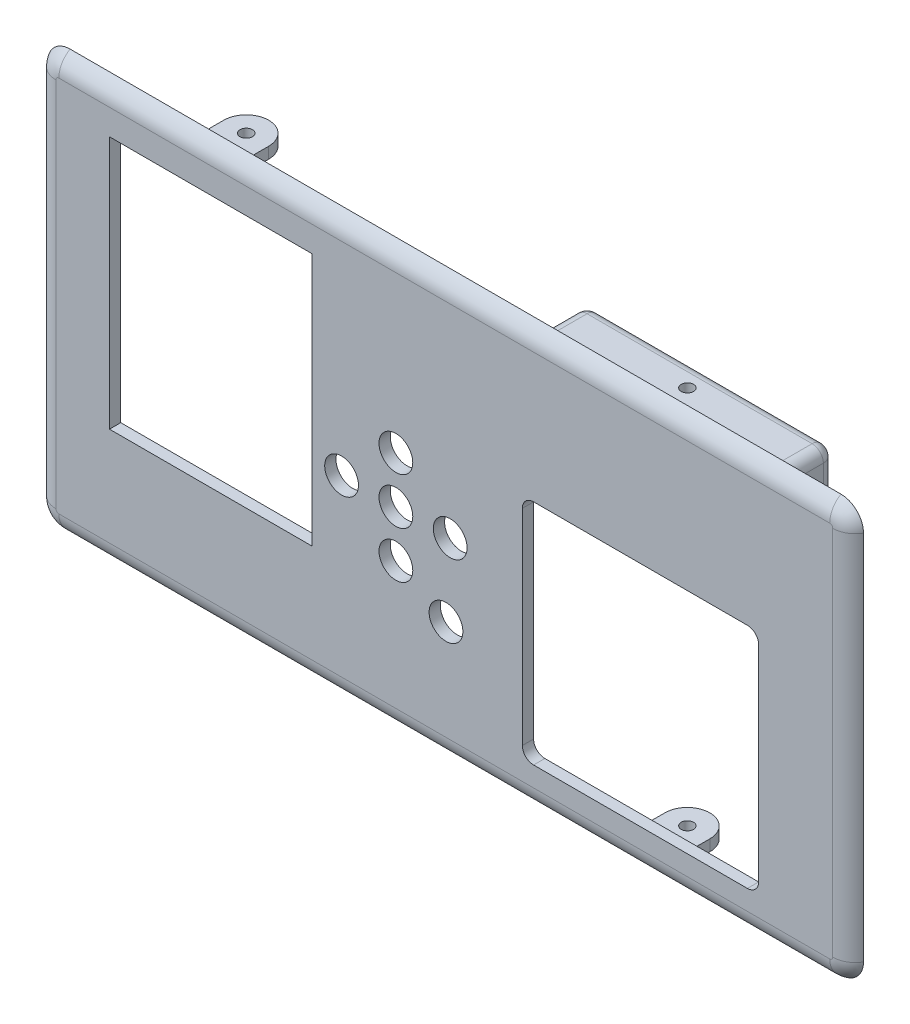
from build123d import *

# Parameters (mm, degrees)
ESBO_O1_W                = 74
ESBO_O1_H                = 145
ESBO_O1_R                = 3
ESBO_O1_W_2              = 45
ESBO_O1_H_2              = 36
ESBO_O1_W_3              = 40.5
ESBO_O1_H_3              = 42
RESSALTO_EXTRUS_O1_DEPTH = 2
CORTE_EXTRUS_O1_DEPTH    = 1.9
ESBO_O3_W                = 140.4
ESBO_O3_H                = 69.4
ESBO_O3_W_2              = 136.4
ESBO_O3_H_2              = 65.4
RESSALTO_EXTRUS_O2_DEPTH = 2
ESBO_O4_W                = 2
ESBO_O4_H                = 20.2
ESBO_O4_W_2              = 44
ESBO_O4_H_2              = 2
RESSALTO_EXTRUS_O3_DEPTH = 9.5
FILETE1_R                = 2
FILETE2_R                = 4
FILETE3_R                = 4
RESSALTO_EXTRUS_O4_START = 32.7
ESBO_O5_R                = 1.1
RESSALTO_EXTRUS_O4_DEPTH = 2
RESSALTO_EXTRUS_O5_START = -34.7
ESBO_O5_2_R              = 1.1
RESSALTO_EXTRUS_O5_DEPTH = 2
CORTE_EXTRUS_O2_START    = 60
ESBO_O6_R                = 1.1
CORTE_EXTRUS_O2_DEPTH    = 10
FILETE4_R                = 2
FILETE5_R                = 2


# Read off the part's stored shape, not the designer's step: Corte-extrusão1
# Some blends are built 0.0001 mm under size
with BuildPart() as part:
    # Esboço1 → Ressalto-extrusão1 (new body)
    with BuildSketch(Plane(origin=(0, 0, 0), x_dir=(0, 1, 0), z_dir=(0, 0, 1))):
        Rectangle(ESBO_O1_W, ESBO_O1_H)
        with Locations(Location((-15.76, -0.3, 0), (0, 0, 270))):
            Circle(ESBO_O1_R, mode=Mode.SUBTRACT)
        with Locations(Location((-2.51, 8.6, 0), (0, 0, 270))):
            Circle(ESBO_O1_R, mode=Mode.SUBTRACT)
        with Locations(Location((-2.51, 18.25, 0), (0, 0, 270))):
            Circle(ESBO_O1_R, mode=Mode.SUBTRACT)
        with Locations(Location((5.79, 8.6, 0), (0, 0, 270))):
            Circle(ESBO_O1_R, mode=Mode.SUBTRACT)
        with Locations(Location((-10.81, 8.6, 0), (0, 0, 270))):
            Circle(ESBO_O1_R, mode=Mode.SUBTRACT)
        with Locations(Location((-2.51, -1.05, 0), (0, 0, 270))):
            Circle(ESBO_O1_R, mode=Mode.SUBTRACT)
        with Locations((6.5, 41.5)):
            Rectangle(ESBO_O1_W_2, ESBO_O1_H_2, mode=Mode.SUBTRACT)
        with Locations((-9.75, -34.87)):
            Rectangle(ESBO_O1_W_3, ESBO_O1_H_3, mode=Mode.SUBTRACT)
    extrude(amount=RESSALTO_EXTRUS_O1_DEPTH)

    # Corte-extrusão1 outline → Corte-extrusão1 (cut)
    with BuildSketch(Plane.XY):
        with BuildLine():
            add(Edge.make_bspline(
                [(47.173076923, 20.014887154), (47.174117402, 19.887144883), (47.176164335, 19.635837546), (47.188599137, 19.265196932), (47.211039871, 18.907881572), (47.241211197, 18.563787309), (47.278695427, 18.23329202), (47.326276713, 17.916098024), (47.38400515, 17.612412265), (47.448100829, 17.320699761), (47.524756168, 17.041630215), (47.612248411, 16.774176813), (47.71048375, 16.516619516), (47.823333752, 16.27112642), (47.948089087, 16.036240474), (48.083511864, 15.811446978), (48.230039877, 15.596118976), (48.339687331, 15.462351114), (48.394230769, 15.395809129)],
                knots=[0, 0, 0, 0, 0.078572897, 0.15457644, 0.228069052, 0.298757677, 0.367016273, 0.432623994, 0.495987006, 0.557124588, 0.616282298, 0.673911173, 0.73015502, 0.78573453, 0.839985447, 0.893658314, 0.947100994, 1, 1, 1, 1], degree=3))
            add(Edge.make_bspline(
                [(48.41808143, 24.452700155), (48.376072031, 24.448933978), (48.289066696, 24.441133878), (48.164716323, 24.375822674), (48.047517354, 24.273758081), (47.936950213, 24.132232592), (47.831026682, 23.953113932), (47.728173244, 23.735847707), (47.631448957, 23.478860366), (47.536419534, 23.187474686), (47.452149745, 22.865001341), (47.377933609, 22.519002909), (47.314584822, 22.152442882), (47.261797032, 21.765361965), (47.223017275, 21.356852294), (47.194674233, 20.927892861), (47.176848872, 20.47826953), (47.174354104, 20.171788272), (47.173076923, 20.014887154)],
                knots=[0, 0, 0, 0, 0.025976356, 0.053799425, 0.085324753, 0.122080032, 0.164756432, 0.214371963, 0.27116, 0.335176716, 0.404637553, 0.478042656, 0.554885277, 0.635604766, 0.720597574, 0.809667408, 0.902560448, 1, 1, 1, 1], degree=3))
            add(Edge.make_bspline(
                [(49.717147436, 18.855745027), (49.715205809, 19.125030084), (49.711404915, 19.652177587), (49.676051144, 20.423825337), (49.617577401, 21.158884465), (49.549548777, 21.745008515), (49.48175624, 22.187734377), (49.432631837, 22.493061738), (49.375908371, 22.774188137), (49.319864514, 23.032924782), (49.258043975, 23.267867674), (49.192719997, 23.479307977), (49.126969256, 23.668526032), (49.055345373, 23.833879765), (48.981316862, 23.978418027), (48.908059534, 24.10442164), (48.830627618, 24.21026197), (48.753991128, 24.299555164), (48.672055656, 24.366670362), (48.589632254, 24.416584129), (48.504396718, 24.446781875), (48.446387138, 24.45075935), (48.41808143, 24.452700155)],
                knots=[0, 0, 0, 0, 0.135045219, 0.264362051, 0.387295344, 0.504802506, 0.560176281, 0.611916125, 0.659875824, 0.703987773, 0.744670877, 0.78166554, 0.814958934, 0.845080233, 0.871946957, 0.896381411, 0.918074, 0.937654067, 0.955215761, 0.970943646, 0.985821986, 1, 1, 1, 1], degree=3))
            Line((49.717147436, 18.855745027), (50.53125, 18.855745027))
            add(Edge.make_bspline(
                [(52.210336538, 25.775616822), (52.17294149, 25.773005571), (52.096942997, 25.767698688), (51.985224838, 25.728341562), (51.87592653, 25.66658728), (51.768521421, 25.580395808), (51.66332117, 25.46966362), (51.563251862, 25.332594748), (51.460001444, 25.175155295), (51.364108014, 24.992407374), (51.267895529, 24.791773706), (51.181550033, 24.571052094), (51.09967634, 24.334782242), (51.020093587, 24.082530437), (50.952386066, 23.812727195), (50.886062678, 23.527317323), (50.827775692, 23.22492747), (50.77474245, 22.900970715), (50.726576213, 22.546321407), (50.683724314, 22.151891944), (50.648582614, 21.712215169), (50.614805548, 21.22780213), (50.586698993, 20.698233695), (50.563093911, 20.124184291), (50.543961592, 19.50509332), (50.535587171, 19.077301409), (50.53125, 18.855745027)],
                knots=[0, 0, 0, 0, 0.015048386, 0.030583051, 0.047220886, 0.065467235, 0.085861122, 0.108586779, 0.133765552, 0.161670299, 0.191670667, 0.223400323, 0.257107107, 0.292439395, 0.329945595, 0.369167682, 0.410511454, 0.454017114, 0.501441039, 0.554723517, 0.613877757, 0.679175906, 0.750404081, 0.827575383, 0.910700101, 1, 1, 1, 1], degree=3))
            add(Edge.make_bspline(
                [(53.889423077, 20.073718785), (53.888030161, 20.283102787), (53.885310382, 20.691941717), (53.860324048, 21.288904323), (53.82420609, 21.854414299), (53.76731057, 22.38769486), (53.699725307, 22.889991174), (53.611019744, 23.36017394), (53.511201853, 23.799080448), (53.411267211, 24.142479037), (53.325736374, 24.398607042), (53.25964573, 24.575154331), (53.195932659, 24.74111878), (53.126825862, 24.893126456), (53.05864041, 25.034032625), (52.9890952, 25.162730252), (52.917705924, 25.279179091), (52.844252955, 25.383195199), (52.769829334, 25.474980144), (52.695295212, 25.556411075), (52.616587902, 25.622226643), (52.539500965, 25.679936919), (52.457959748, 25.72053042), (52.377862728, 25.75385708), (52.2943039, 25.771561189), (52.238498379, 25.774256602), (52.210336538, 25.775616822)],
                knots=[0, 0, 0, 0, 0.100445637, 0.1961281, 0.286600843, 0.37224573, 0.453370973, 0.529673874, 0.601715122, 0.669229587, 0.701151659, 0.731239722, 0.759664826, 0.786411815, 0.811316234, 0.834754852, 0.856560099, 0.876807909, 0.895789985, 0.913238703, 0.929648632, 0.944959968, 0.959289745, 0.973219138, 0.986485238, 1, 1, 1, 1], degree=3))
            add(Edge.make_bspline(
                [(53.460111178, 16.337115219), (53.494757466, 16.462947421), (53.566114049, 16.722108116), (53.651428458, 17.127444428), (53.726795753, 17.557394983), (53.786499376, 18.012078063), (53.832164822, 18.492094122), (53.8648751, 18.996899426), (53.886437951, 19.52708572), (53.88841282, 19.888721634), (53.889423077, 20.073718785)],
                knots=[0, 0, 0, 0, 0.103749396, 0.213679529, 0.329170671, 0.450752515, 0.578183648, 0.71248325, 0.852918978, 1, 1, 1, 1], degree=3))
            add(Edge.make_bspline(
                [(52.362980769, 14.581706565), (52.424956711, 14.634132297), (52.549654141, 14.739614422), (52.719468867, 14.919493477), (52.877179906, 15.114927831), (53.020320639, 15.327725282), (53.15095416, 15.555738454), (53.268629686, 15.800210055), (53.37464325, 16.061139096), (53.431241934, 16.243896367), (53.460111178, 16.337115219)],
                knots=[0, 0, 0, 0, 0.115770177, 0.23293302, 0.352361737, 0.473830575, 0.59851621, 0.727069683, 0.860786655, 1, 1, 1, 1], degree=3))
            Line((52.362980769, 14.581706565), (52.362980769, 12.241161693))
            add(Edge.make_bspline(
                [(54.703525641, 20.033967683), (54.701552521, 19.783782649), (54.697688705, 19.293863617), (54.671625107, 18.574734518), (54.622498237, 17.887771016), (54.561359899, 17.231920289), (54.475943016, 16.607947712), (54.375697017, 16.015135884), (54.255173494, 15.454224548), (54.136983855, 15.009058713), (54.035098553, 14.670475035), (53.953413472, 14.430964405), (53.868050064, 14.202947786), (53.778658722, 13.985426581), (53.685288067, 13.77886681), (53.586931429, 13.583763428), (53.484592367, 13.399673681), (53.378535309, 13.226323702), (53.267039463, 13.063971531), (53.15165886, 12.912465642), (53.029528299, 12.774285893), (52.906150218, 12.644504467), (52.777025489, 12.52725488), (52.644609747, 12.419369389), (52.506596519, 12.324132272), (52.410531692, 12.268633106), (52.362980769, 12.241161693)],
                knots=[0, 0, 0, 0, 0.088886706, 0.174060327, 0.255603603, 0.333549665, 0.408036485, 0.479300312, 0.547110699, 0.611786503, 0.642881203, 0.672714774, 0.701674448, 0.729369875, 0.756252549, 0.782190026, 0.806972588, 0.83106521, 0.854360183, 0.876920552, 0.898673545, 0.919848336, 0.940507791, 0.960593756, 0.980494388, 1, 1, 1, 1], degree=3))
            add(Edge.make_bspline(
                [(52.141964643, 28.116161693), (52.198024043, 28.113309586), (52.311916251, 28.107515146), (52.479363624, 28.051965586), (52.645025303, 27.968799498), (52.807251424, 27.849134176), (52.966873682, 27.697248217), (53.124893852, 27.512789049), (53.278240982, 27.294178305), (53.431787395, 27.046326694), (53.578190339, 26.768483054), (53.71789912, 26.465822489), (53.850209642, 26.139213722), (53.971964386, 25.787673002), (54.08431518, 25.411794764), (54.188939061, 25.012384879), (54.286276814, 24.588867984), (54.372681903, 24.14216899), (54.449795031, 23.676543969), (54.518732944, 23.196345668), (54.575038823, 22.702598688), (54.624047975, 22.195433528), (54.656973945, 21.6740478), (54.685175507, 21.139300885), (54.70111383, 20.591111629), (54.702715687, 20.221072378), (54.703525641, 20.033967683)],
                knots=[0, 0, 0, 0, 0.018753924, 0.038101119, 0.058616525, 0.080774388, 0.105428344, 0.132408932, 0.162110759, 0.194924196, 0.230160854, 0.267391214, 0.306715309, 0.348326823, 0.392146465, 0.438292407, 0.486816032, 0.53790158, 0.590897092, 0.645135551, 0.700625293, 0.75759512, 0.816045953, 0.8758646, 0.937232831, 1, 1, 1, 1], degree=3))
            add(Edge.make_bspline(
                [(50.731595553, 26.604029782), (50.78270337, 26.723130137), (50.879658004, 26.949070745), (51.046504159, 27.256255653), (51.212346246, 27.52014818), (51.388350916, 27.733667125), (51.566928739, 27.903005932), (51.751538044, 28.026615206), (51.945201089, 28.101263249), (52.077252133, 28.111261824), (52.141964643, 28.116161693)],
                knots=[0, 0, 0, 0, 0.178333778, 0.338310009, 0.480800466, 0.606741991, 0.71826832, 0.818451927, 0.911031135, 1, 1, 1, 1], degree=3))
            add(Edge.make_bspline(
                [(50.054236779, 23.862793805), (50.074415407, 23.999083607), (50.113890167, 24.265702685), (50.180104396, 24.655665274), (50.254403717, 25.026434815), (50.338033406, 25.378039883), (50.424524896, 25.711951131), (50.518024996, 26.027266873), (50.619188703, 26.323379554), (50.694776171, 26.512101507), (50.731595553, 26.604029782)],
                knots=[0, 0, 0, 0, 0.145998156, 0.285611199, 0.419112946, 0.546628653, 0.668554587, 0.784594676, 0.895073998, 1, 1, 1, 1], degree=3))
            add(Edge.make_bspline(
                [(48.421261518, 26.793245027), (48.463918677, 26.791247334), (48.549624759, 26.787233602), (48.675285101, 26.749581121), (48.797261841, 26.692082618), (48.914937652, 26.61001477), (49.029210682, 26.506357199), (49.139195231, 26.378293673), (49.247077494, 26.229106331), (49.349802378, 26.056009303), (49.450225706, 25.861189772), (49.546402913, 25.643153807), (49.640202633, 25.402278737), (49.730702034, 25.138736511), (49.815413736, 24.85170362), (49.90017777, 24.542894652), (49.981375429, 24.211097471), (50.029480273, 23.981138877), (50.054236779, 23.862793805)],
                knots=[0, 0, 0, 0, 0.035929926, 0.072189835, 0.109815248, 0.149403222, 0.192802437, 0.239731941, 0.291639746, 0.34803706, 0.409469869, 0.476567142, 0.54910076, 0.627628075, 0.711708692, 0.801687982, 0.897941408, 1, 1, 1, 1], degree=3))
            add(Edge.make_bspline(
                [(46.358974359, 19.987856405), (46.360011299, 20.141038677), (46.362064002, 20.444274803), (46.374796256, 20.895430432), (46.396787184, 21.338651363), (46.429031663, 21.773818295), (46.468195277, 22.201221444), (46.518011475, 22.620449712), (46.574631663, 23.032538593), (46.641077965, 23.434412386), (46.715621327, 23.820726525), (46.793793094, 24.187680748), (46.882303328, 24.53078067), (46.972999772, 24.852953049), (47.073613224, 25.151163957), (47.178041613, 25.427473537), (47.289101617, 25.680849371), (47.406120063, 25.910635054), (47.526672048, 26.116472161), (47.649047479, 26.295864043), (47.774475444, 26.447179351), (47.898885219, 26.573210919), (48.027758775, 26.669147609), (48.155517683, 26.742822066), (48.288459256, 26.783615376), (48.377565096, 26.790076547), (48.421261518, 26.793245027)],
                knots=[0, 0, 0, 0, 0.061522925, 0.121789376, 0.181255005, 0.23973673, 0.297033736, 0.353617695, 0.409281226, 0.46408456, 0.517188848, 0.567292642, 0.614739876, 0.659477158, 0.701684094, 0.741099664, 0.778080995, 0.812734476, 0.844606121, 0.873834583, 0.899836187, 0.923468662, 0.944755724, 0.964191174, 0.982439786, 1, 1, 1, 1], degree=3))
            add(Edge.make_bspline(
                [(48.394230769, 13.055264257), (48.313016273, 13.114707933), (48.147305054, 13.235997657), (47.924740119, 13.462293788), (47.714021417, 13.722397017), (47.519261748, 14.021624762), (47.337648916, 14.357222009), (47.171833496, 14.731093254), (47.017434849, 15.141190775), (46.881450407, 15.587452477), (46.757654768, 16.062082053), (46.652353468, 16.561122439), (46.561528229, 17.080832442), (46.486817266, 17.621211218), (46.430194421, 18.183469857), (46.389473923, 18.766227991), (46.362886816, 19.370141551), (46.360293836, 19.779531936), (46.358974359, 19.987856405)],
                knots=[0, 0, 0, 0, 0.040465058, 0.082565483, 0.127325091, 0.175089529, 0.226080975, 0.280813404, 0.339633282, 0.402406998, 0.468555501, 0.537071535, 0.607695341, 0.680941308, 0.756662244, 0.835176347, 0.916127, 1, 1, 1, 1], degree=3))
            Line((48.394230769, 13.055264257), (48.394230769, 15.395809129))
        make_face()
        with BuildLine():
            add(Edge.make_bspline(
                [(33.173076923, 20.506210772), (33.174611941, 20.323328506), (33.177611959, 19.965905972), (33.200778885, 19.441534659), (33.235298829, 18.940639039), (33.291111262, 18.463151524), (33.35573695, 18.008648313), (33.439316042, 17.57809525), (33.535235772, 17.1707325), (33.646855853, 16.789265235), (33.772814359, 16.4396801), (33.909362295, 16.126256517), (34.061383714, 15.854149945), (34.221993853, 15.619312101), (34.398755767, 15.425557077), (34.586819618, 15.270843707), (34.788631835, 15.154403218), (34.933234858, 15.111671296), (35.004807692, 15.090520668)],
                knots=[0, 0, 0, 0, 0.091004275, 0.177857478, 0.261160787, 0.340793172, 0.417035529, 0.48955748, 0.558968581, 0.625234079, 0.687224967, 0.743784419, 0.795148543, 0.842123207, 0.885059054, 0.925180702, 0.962967377, 1, 1, 1, 1], degree=3))
            add(Edge.make_bspline(
                [(34.782201522, 25.572091181), (34.727357097, 25.567962759), (34.615288111, 25.55952675), (34.455471655, 25.481901114), (34.303569854, 25.363740433), (34.159165562, 25.198911853), (34.019444838, 24.990569378), (33.889577855, 24.73512848), (33.762330237, 24.436005361), (33.642619077, 24.095374033), (33.532563611, 23.721158073), (33.435823322, 23.322691839), (33.35527719, 22.903351708), (33.288685218, 22.46361531), (33.236204457, 22.003281168), (33.200573582, 21.522169663), (33.177729005, 21.021076273), (33.174647934, 20.680081201), (33.173076923, 20.506210772)],
                knots=[0, 0, 0, 0, 0.029204739, 0.059676902, 0.093264148, 0.131827509, 0.176357847, 0.227235365, 0.284930329, 0.350245198, 0.420344032, 0.493615504, 0.569608202, 0.64880007, 0.73159279, 0.817506641, 0.906948219, 1, 1, 1, 1], degree=3))
            add(Edge.make_bspline(
                [(37.21496895, 21.202650075), (37.175431813, 21.314030482), (37.098145637, 21.531754027), (36.981194357, 21.849784142), (36.870518744, 22.153910446), (36.762178256, 22.442494062), (36.659059704, 22.716806081), (36.558779041, 22.975213377), (36.463479287, 23.219274279), (36.371287422, 23.448267536), (36.282438552, 23.662264915), (36.197822373, 23.861410023), (36.118588311, 24.046206346), (36.042873771, 24.216126811), (35.969026268, 24.370331224), (35.901191502, 24.510802316), (35.836222348, 24.635783965), (35.757246464, 24.779625521), (35.661267977, 24.938735826), (35.540206722, 25.105521586), (35.419711839, 25.249308842), (35.296108928, 25.36606254), (35.170335962, 25.456853681), (35.043860967, 25.524369153), (34.913372002, 25.56425857), (34.825379214, 25.569512902), (34.782201522, 25.572091181)],
                knots=[0, 0, 0, 0, 0.068472932, 0.133849121, 0.196313442, 0.25597279, 0.312433677, 0.36609382, 0.416558297, 0.464227738, 0.50910665, 0.550797555, 0.589585211, 0.625595803, 0.658560721, 0.688635936, 0.715966523, 0.74015466, 0.783707165, 0.823508633, 0.859445835, 0.892250185, 0.921734904, 0.949065491, 0.97500665, 1, 1, 1, 1], degree=3))
            Line((37.21496895, 21.202650075), (40.5, 12.241161693))
            Line((40.5, 12.241161693), (40.5, 28.217924514))
            Line((40.5, 28.217924514), (39.685897436, 28.217924514))
            Line((39.685897436, 28.217924514), (39.685897436, 17.644131445))
            Line((39.685897436, 17.644131445), (37.639510717, 23.226776177))
            add(Edge.make_bspline(
                [(34.751990685, 27.912636052), (34.808516734, 27.910158955), (34.922411663, 27.905167825), (35.090052628, 27.854860849), (35.255486219, 27.779968088), (35.417104134, 27.672787581), (35.575068509, 27.535528783), (35.73032519, 27.369237283), (35.883952662, 27.173788302), (36.005107444, 26.987534525), (36.105019548, 26.821450817), (36.183809577, 26.680007631), (36.267342967, 26.525122628), (36.352241046, 26.355509117), (36.441318051, 26.17187853), (36.535663514, 25.975436617), (36.630598679, 25.76346536), (36.728783946, 25.537273123), (36.832938615, 25.297953259), (36.936931323, 25.042693467), (37.046722541, 24.774757527), (37.160227263, 24.49322633), (37.274204445, 24.196326782), (37.393268852, 23.885868708), (37.51599893, 23.561074458), (37.59778109, 23.339722016), (37.639510717, 23.226776177)],
                knots=[0, 0, 0, 0, 0.029519451, 0.059479052, 0.090895187, 0.124374657, 0.16058219, 0.200234683, 0.243312247, 0.290566579, 0.316454791, 0.344781579, 0.37532154, 0.408579487, 0.444072883, 0.482177616, 0.52266505, 0.565660313, 0.611278027, 0.659304924, 0.709958272, 0.762877594, 0.818222164, 0.876455438, 0.936960965, 1, 1, 1, 1], degree=3))
            add(Edge.make_bspline(
                [(32.358974359, 20.620693945), (32.361003865, 20.885738108), (32.364967151, 21.403325004), (32.398923916, 22.160588734), (32.453614623, 22.879252144), (32.530924818, 23.558801031), (32.630553975, 24.199226018), (32.752416932, 24.801093734), (32.896134176, 25.364556519), (33.036812332, 25.806827476), (33.158802123, 26.136919962), (33.251519894, 26.365278311), (33.344907253, 26.578119298), (33.439816263, 26.7760063), (33.538565639, 26.957152576), (33.6384456, 27.122974711), (33.740251362, 27.272731257), (33.843255384, 27.407533654), (33.950577742, 27.525094325), (34.057563552, 27.629380702), (34.168905886, 27.716029517), (34.280691599, 27.788046249), (34.395784907, 27.842910174), (34.51237837, 27.883284942), (34.631711761, 27.907882445), (34.712130827, 27.91106073), (34.751990685, 27.912636052)],
                knots=[0, 0, 0, 0, 0.097851436, 0.191087479, 0.279801282, 0.363906581, 0.443531572, 0.519019079, 0.590543276, 0.658122464, 0.690255729, 0.720452583, 0.749103376, 0.776059471, 0.801453154, 0.825247036, 0.847499981, 0.868283948, 0.887818043, 0.906225836, 0.923371347, 0.939820421, 0.955224842, 0.97032422, 0.985291145, 1, 1, 1, 1], degree=3))
            add(Edge.make_bspline(
                [(35.004807692, 12.749975796), (34.95691354, 12.755762625), (34.861113652, 12.767337682), (34.720098218, 12.804774625), (34.58240317, 12.859185548), (34.448671747, 12.931743584), (34.317911635, 13.019194938), (34.191394415, 13.124345879), (34.067169442, 13.245274994), (33.947034583, 13.38433561), (33.828497871, 13.538614938), (33.716764896, 13.71171585), (33.604753892, 13.899380017), (33.497008597, 14.104250852), (33.394169712, 14.326735545), (33.291975448, 14.564269873), (33.195802551, 14.820096172), (33.066788704, 15.185880157), (32.92126989, 15.671064732), (32.770008612, 16.281289478), (32.643957348, 16.92466954), (32.538945048, 17.600376291), (32.45886901, 18.309170027), (32.400240639, 19.050510195), (32.364747644, 19.824791263), (32.360923845, 20.351938673), (32.358974359, 20.620693945)],
                knots=[0, 0, 0, 0, 0.016461158, 0.032926296, 0.049666769, 0.06691723, 0.084790908, 0.103310194, 0.123024261, 0.143936145, 0.166021699, 0.189418534, 0.214255002, 0.240652731, 0.268430186, 0.297951932, 0.328949189, 0.361754342, 0.430416506, 0.501849312, 0.576402683, 0.654259642, 0.735342208, 0.819964433, 0.908212567, 1, 1, 1, 1], degree=3))
            Line((35.004807692, 12.749975796), (35.004807692, 15.090520668))
        make_face()
        Polygon((17.916666667, 23.47032836), (17.916666667, 17.326398072), (19.002136752, 15.46498648), (19.002136752, 20.349601864), (28.5, 20.349601864), (28.5, 23.47032836), align=None)
    extrude(amount=CORTE_EXTRUS_O1_DEPTH, mode=Mode.SUBTRACT)

    # Esboço3 → Ressalto-extrusão2 (add)
    with BuildSketch(Plane(origin=(0, 0, 0), x_dir=(1, 0, 0), z_dir=(0, 0, -1))):
        Rectangle(ESBO_O3_W, ESBO_O3_H)
        Rectangle(ESBO_O3_W_2, ESBO_O3_H_2, mode=Mode.SUBTRACT)
    extrude(amount=RESSALTO_EXTRUS_O2_DEPTH)

    # Esboço4 → Ressalto-extrusão3 (add)
    with BuildSketch(Plane(origin=(0, 0, 0), x_dir=(1, 0, 0), z_dir=(0, 0, -1))):
        with Locations((14.87, -22.6)):
            Rectangle(ESBO_O4_W, ESBO_O4_H)
        with Locations((35.87, -11.5)):
            Rectangle(ESBO_O4_W_2, ESBO_O4_H_2)
        with Locations((29.87, -22.6)):
            Rectangle(ESBO_O4_W, ESBO_O4_H)
        with Locations((42.87, -22.6)):
            Rectangle(ESBO_O4_W, ESBO_O4_H)
        with Locations((56.87, -22.6)):
            Rectangle(ESBO_O4_W, ESBO_O4_H)
        with Locations((35.87, -33.7)):
            Rectangle(ESBO_O4_W_2, ESBO_O4_H_2)
    extrude(amount=RESSALTO_EXTRUS_O3_DEPTH)

    # Filete1
    # the kernel refuses this fillet: 2 mm, written as the material it adds along each edge
    with BuildSketch(Plane(origin=(55.87, 32.7, 0), x_dir=(-1, 0, 0), z_dir=(0, 0, -1)), Plane(origin=(43.87, 32.7, -9.5), x_dir=(1, 0, 0), z_dir=(0, 0, 1)), Plane(origin=(41.87, 32.7, 0), x_dir=(-1, 0, 0), z_dir=(0, 0, -1)), Plane(origin=(30.87, 32.7, -9.5), x_dir=(1, 0, 0), z_dir=(0, 0, 1)), Plane(origin=(28.87, 32.7, 0), x_dir=(-1, 0, 0), z_dir=(0, 0, -1)), Plane(origin=(15.87, 12.5, 0), x_dir=(1, 0, 0), z_dir=(0, 0, -1)), Plane(origin=(28.87, 12.5, 0), x_dir=(0, 1, 0), z_dir=(0, 0, -1)), Plane(origin=(30.87, 12.5, 0), x_dir=(1, 0, 0), z_dir=(0, 0, -1)), Plane(origin=(41.87, 12.5, 0), x_dir=(0, 1, 0), z_dir=(0, 0, -1)), Plane(origin=(43.87, 12.5, 0), x_dir=(1, 0, 0), z_dir=(0, 0, -1)), Plane(origin=(55.87, 12.5, 0), x_dir=(0, 1, 0), z_dir=(0, 0, -1))) as filete1_piece_1:
        with BuildLine():
            CenterArc((FILETE1_R, -FILETE1_R), FILETE1_R, 90, 90)
            Line((0, -FILETE1_R), (0, 0))
            Line((0, 0), (FILETE1_R, 0))
        make_face()
    extrude(amount=9.5)
    # the kernel refuses this fillet: 2 mm, written as the material it takes off along each edge
    with BuildSketch(Plane(origin=(57.87, 34.7, -2), x_dir=(-1, 0, 0), z_dir=(0, 0, -1))) as filete1_2_piece_1:
        with BuildLine():
            CenterArc((FILETE1_R, -FILETE1_R), FILETE1_R, 90, 90)
            Line((0, -FILETE1_R), (0, 0))
            Line((0, 0), (FILETE1_R, 0))
        make_face()
    extrude(amount=12.5, mode=Mode.SUBTRACT)
    with BuildSketch(Plane(origin=(57.87, 10.5, 0), x_dir=(0, 1, 0), z_dir=(0, 0, -1))) as filete1_2_piece_2:
        with BuildLine():
            CenterArc((FILETE1_R, -FILETE1_R), FILETE1_R, 90, 90)
            Line((0, -FILETE1_R), (0, 0))
            Line((0, 0), (FILETE1_R, 0))
        make_face()
    extrude(amount=14.5, mode=Mode.SUBTRACT)
    with BuildSketch(Plane(origin=(13.87, 10.5, 0), x_dir=(0, 1, 0), z_dir=(0, 0, -1))) as filete1_2_piece_3:
        with BuildLine():
            CenterArc((FILETE1_R, FILETE1_R), FILETE1_R, 180, 90)
            Line((0, FILETE1_R), (0, 0))
            Line((0, 0), (FILETE1_R, 0))
        make_face()
    extrude(amount=14.5, mode=Mode.SUBTRACT)
    with BuildSketch(Plane(origin=(13.87, 34.7, -2), x_dir=(1, 0, 0), z_dir=(0, 0, -1))) as filete1_2_piece_4:
        with BuildLine():
            CenterArc((FILETE1_R, FILETE1_R), FILETE1_R, 180, 90)
            Line((0, FILETE1_R), (0, 0))
            Line((0, 0), (FILETE1_R, 0))
        make_face()
    extrude(amount=12.5, mode=Mode.SUBTRACT)

    # Filete2
    filete2_edges = [part.edges().sort_by_distance(p)[0] for p in [
        (-70.2, 34.7, -1),
        (70.2, 34.7, -1),
        (70.2, -34.7, -1),
        (-70.2, -34.7, -1),
        (68.2, 32.7, -1),
        (68.2, -32.7, -1),
        (-68.2, -32.7, -1),
        (-68.2, 32.7, -1),
        (72.5, 37, 1),
        (72.5, -37, 1),
        (-72.5, -37, 1),
        (-72.5, 37, 1),
    ]]
    fillet(filete2_edges, radius=FILETE2_R)

    # Filete3
    # the kernel refuses this fillet: 4 mm, written as the material it takes off along each edge
    with BuildSketch(Plane(origin=(-68.5, -33, 2), x_dir=(0, -1, 0), z_dir=(1, 0, 0))) as filete3_piece_1:
        with BuildLine():
            CenterArc((0.535898385, 4), FILETE3_R, 270, 60)
            Line((0.535898385, 0), (0.535898385, -0.08))
            Line((0.535898385, -0.08), (4, -0.08))
            Line((4, -0.08), (4.08, 0))
            ThreePointArc((4.08, 0), (4.08, 1), (4.069282032, 1.96))
            Line((4.069282032, 1.96), (4, 2))
        make_face()
    revolve(axis=Axis((-68.5, -33, 2), (0, 0, -1)), revolution_arc=90, mode=Mode.SUBTRACT)
    with BuildSketch(Plane(origin=(-72.5, -33, 2), x_dir=(0, 0, -1), z_dir=(0, 1, 0)), Plane(origin=(72.5, 33, 2), x_dir=(0, 0, -1), z_dir=(0, -1, 0))) as filete3_piece_2:
        with BuildLine():
            CenterArc((4, -3.464101615), FILETE3_R, 120, 60)
            Line((0, -3.464101615), (-0.08, -3.464101615))
            Line((-0.08, -3.464101615), (-0.08, 0))
            Line((-0.08, 0), (0, 0.08))
            ThreePointArc((0, 0.08), (1, 0.08), (1.96, 0.069282032))
            Line((1.96, 0.069282032), (2, 0))
        make_face()
    extrude(amount=66, mode=Mode.SUBTRACT)
    with BuildSketch(Plane(origin=(-68.5, 33, 2), x_dir=(0, 1, 0), z_dir=(1, 0, 0))) as filete3_piece_3:
        with BuildLine():
            CenterArc((0.535898385, -4), FILETE3_R, 30, 60)
            Line((0.535898385, 0), (0.535898385, 0.08))
            Line((0.535898385, 0.08), (4, 0.08))
            Line((4, 0.08), (4.08, 0))
            ThreePointArc((4.08, 0), (4.08, -1), (4.069282032, -1.96))
            Line((4.069282032, -1.96), (4, -2))
        make_face()
    revolve(axis=Axis((-68.5, 33, 2), (0, 0, 1)), revolution_arc=90, mode=Mode.SUBTRACT)
    with BuildSketch(Plane(origin=(-68.5, 37, 2), x_dir=(0, 0, -1), z_dir=(1, 0, 0)), Plane(origin=(68.5, -37, 2), x_dir=(0, 0, -1), z_dir=(-1, 0, 0))) as filete3_piece_4:
        with BuildLine():
            CenterArc((4, -3.464101615), FILETE3_R, 120, 60)
            Line((0, -3.464101615), (-0.08, -3.464101615))
            Line((-0.08, -3.464101615), (-0.08, 0))
            Line((-0.08, 0), (0, 0.08))
            ThreePointArc((0, 0.08), (1, 0.08), (1.96, 0.069282032))
            Line((1.96, 0.069282032), (2, 0))
        make_face()
    extrude(amount=137, mode=Mode.SUBTRACT)
    with BuildSketch(Plane(origin=(68.5, 33, 2), x_dir=(1, 0, 0), z_dir=(0, -1, 0))) as filete3_piece_5:
        with BuildLine():
            CenterArc((0.535898385, -4), FILETE3_R, 30, 60)
            Line((0.535898385, 0), (0.535898385, 0.08))
            Line((0.535898385, 0.08), (4, 0.08))
            Line((4, 0.08), (4.08, 0))
            ThreePointArc((4.08, 0), (4.08, -1), (4.069282032, -1.96))
            Line((4.069282032, -1.96), (4, -2))
        make_face()
    revolve(axis=Axis((68.5, 33, 2), (0, 0, 1)), revolution_arc=90, mode=Mode.SUBTRACT)
    with BuildSketch(Plane(origin=(68.5, -33, 2), x_dir=(0, -1, 0), z_dir=(-1, 0, 0))) as filete3_piece_6:
        with BuildLine():
            CenterArc((0.535898385, -4), FILETE3_R, 30, 60)
            Line((0.535898385, 0), (0.535898385, 0.08))
            Line((0.535898385, 0.08), (4, 0.08))
            Line((4, 0.08), (4.08, 0))
            ThreePointArc((4.08, 0), (4.08, -1), (4.069282032, -1.96))
            Line((4.069282032, -1.96), (4, -2))
        make_face()
    revolve(axis=Axis((68.5, -33, 2), (0, 0, 1)), revolution_arc=90, mode=Mode.SUBTRACT)

    # Esboço5 → Ressalto-extrusão4 (add)
    # profile 1 of 2: a face of its own
    with BuildSketch(Plane(origin=(0, 0, 0), x_dir=(-1, 0, 0), z_dir=(0, 1, 0)).offset(RESSALTO_EXTRUS_O4_START)):
        with BuildLine():
            Line((-40.2, 0), (-32.2, 0))
            Line((-32.2, 0), (-32.2, -5))
            ThreePointArc((-32.2, -5), (-36.2, -9), (-40.2, -5))
            Line((-40.2, -5), (-40.2, 0))
        make_face()
        with Locations((-36.2, -5)):
            Circle(ESBO_O5_R, mode=Mode.SUBTRACT)
    # profile 2 of 2: a face of its own
    with BuildSketch(Plane(origin=(0, 0, 0), x_dir=(-1, 0, 0), z_dir=(0, 1, 0)).offset(RESSALTO_EXTRUS_O4_START)):
        with BuildLine():
            Line((38.2, 0), (46.2, 0))
            Line((46.2, 0), (46.2, -5))
            ThreePointArc((46.2, -5), (42.2, -9), (38.2, -5))
            Line((38.2, -5), (38.2, 0))
        make_face()
        with Locations(Location((42.2, -5, 0), (0, 0, 90))):
            Circle(ESBO_O5_R, mode=Mode.SUBTRACT)
    extrude(amount=RESSALTO_EXTRUS_O4_DEPTH)

    # Esboço5<2> → Ressalto-extrusão5 (add)
    # profile 1 of 2: a face of its own
    with BuildSketch(Plane(origin=(0, 0, 0), x_dir=(-1, 0, 0), z_dir=(0, 1, 0)).offset(RESSALTO_EXTRUS_O5_START)):
        with BuildLine():
            Line((-40.2, 0), (-32.2, 0))
            Line((-32.2, 0), (-32.2, -5))
            ThreePointArc((-32.2, -5), (-36.2, -9), (-40.2, -5))
            Line((-40.2, -5), (-40.2, 0))
        make_face()
        with Locations(Location((-36.2, -5, 0), (0, 0, 90))):
            Circle(ESBO_O5_2_R, mode=Mode.SUBTRACT)
    # profile 2 of 2: a face of its own
    with BuildSketch(Plane(origin=(0, 0, 0), x_dir=(-1, 0, 0), z_dir=(0, 1, 0)).offset(RESSALTO_EXTRUS_O5_START)):
        with BuildLine():
            Line((38.2, 0), (46.2, 0))
            Line((46.2, 0), (46.2, -5))
            ThreePointArc((46.2, -5), (42.2, -9), (38.2, -5))
            Line((38.2, -5), (38.2, 0))
        make_face()
        with Locations(Location((42.2, -5, 0), (0, 0, 90))):
            Circle(ESBO_O5_2_R, mode=Mode.SUBTRACT)
    extrude(amount=RESSALTO_EXTRUS_O5_DEPTH)

    # Esboço6 → Corte-extrusão2 (cut)
    with BuildSketch(Plane(origin=(0, -32.7, 0), x_dir=(-1, 0, 0), z_dir=(0, 1, 0)).offset(CORTE_EXTRUS_O2_START)):
        with Locations(Location((-36.2, -5, 0), (0, 0, 90))):
            Circle(ESBO_O6_R)
    extrude(amount=CORTE_EXTRUS_O2_DEPTH, mode=Mode.SUBTRACT)

    # Filete4
    filete4_edges = [part.edges().sort_by_distance(p)[0] for p in [
        (55.87, 10.5, 1),
        (13.87, 10.5, 1),
        (13.87, -30, 1),
        (55.87, -30, 1),
    ]]
    fillet(filete4_edges, radius=FILETE4_R)

    # Filete5
    filete5_edges = [part.edges().sort_by_distance(p)[0] for p in [
        (57.87, 22.6, -9.5),
        (35.87, 34.7, -9.5),
        (35.87, 10.5, -9.5),
        (13.87, 22.6, -9.5),
        (14.455786438, 11.085786438, -9.5),
        (57.284213562, 11.085786438, -9.5),
        (14.455786438, 34.114213562, -9.5),
        (57.284213562, 34.114213562, -9.5),
    ]]
    fillet(filete5_edges, radius=FILETE5_R - 0.0001)  # a hair under: the kernel refuses the full size


solid = part.part
